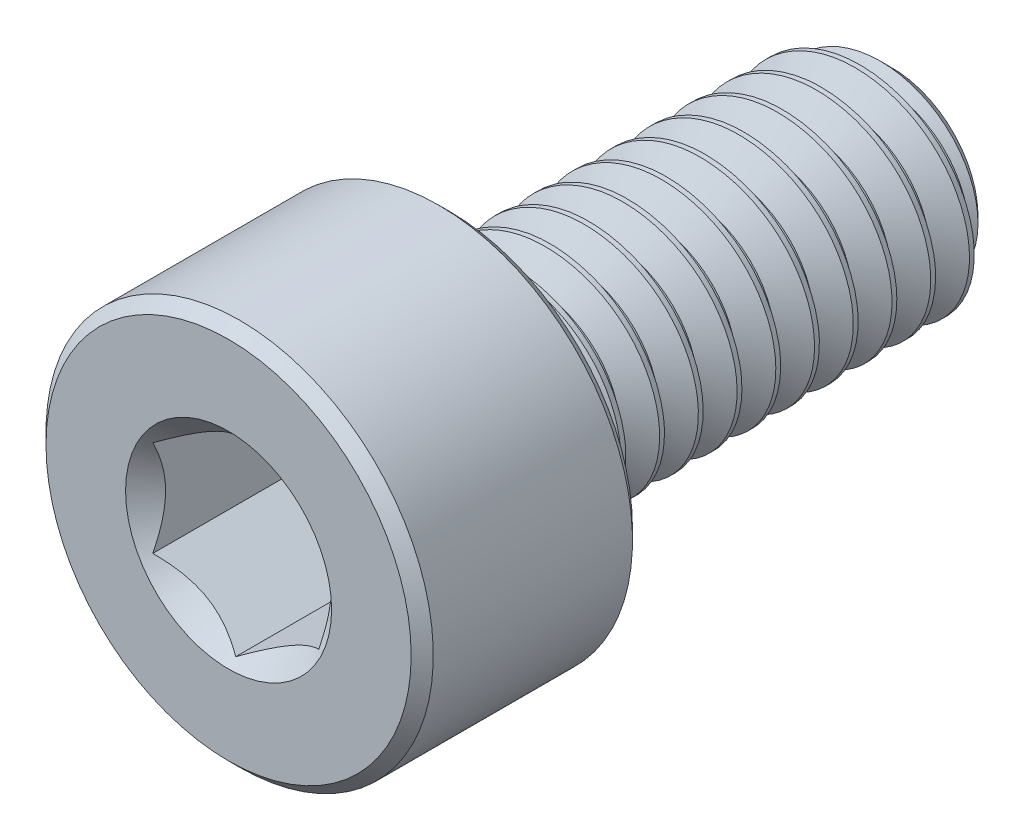
from build123d import *

# Parameters (mm, degrees)
CUT_EXTRUDE1_DEPTH     = 3
SPLIT1_SURFACE_1_BACK  = 16.556
SPLIT1_SURFACE_1_DEPTH = 33.112
SPLIT1_SURFACE_2_BACK  = 16.556
SPLIT1_SURFACE_2_DEPTH = 33.112
CUT_SWEEP1_PITCH       = 0.7


with BuildPart() as part:
    # Sketch2 → Revolve1 (revolve)
    with BuildSketch(Plane(origin=(0, 0, 0), x_dir=(0, 0, -1), z_dir=(1, 0, 0))):
        with BuildLine():
            Line((-6, 0), (-6, 3.3))
            Line((-6, 3.3), (-5.8, 3.5))
            Line((-5.8, 3.5), (-2.2, 3.5))
            Line((-2.2, 3.5), (-2, 3.3))
            Line((-2, 3.3), (-2, 2.2))
            ThreePointArc((-2, 2.2), (-1.941421356, 2.058578644), (-1.8, 2))
            Line((-1.8, 2), (5.545336663, 2))
            Line((5.545336663, 2), (6, 1.545336663))
            Line((6, 1.545336663), (6, 0))
            Line((6, 0), (-6, 0))
        make_face()
    revolve(axis=Axis((0, 0, -6), (0, 0, 1)))

    # Sketch3 → Cut-Extrude1 (cut)
    with BuildSketch(Plane.XY.offset(6)):
        Polygon((1.5, -0.866025404), (1.5, 0.866025404), (0, 1.732050808), (-1.5, 0.866025404), (-1.5, -0.866025404), (0, -1.732050808), align=None)
    extrude(amount=-CUT_EXTRUDE1_DEPTH, mode=Mode.SUBTRACT)

    # Cut-Extrude2 cone 1 section (through the dimple's axis) → Cut-Extrude2 (revolve, cut)
    with BuildSketch(Plane(origin=(0, 0, 6), x_dir=(0, -1, 0), z_dir=(1, 0, 0))):
        Polygon((0, 0), (1.861954618, 0), (0, 1.861954618), align=None)
    revolve(axis=Axis((0, 0, 6), (0, 0, -1)), mode=Mode.SUBTRACT)


with BuildPart() as body_2:
    # Split1: the piece behind the surface
    add(part.part)
    # Split1 surface: a surface, the sketch's curves swept straight by 33.112 mm
    with BuildLine(Plane(origin=(0, 0, 0), x_dir=(0, 0, -1), z_dir=(1, 0, 0)).offset(-SPLIT1_SURFACE_1_BACK), mode=Mode.PRIVATE) as split1_surface_1_path:
        Line((-1.8, -3.5), (-1.8, 3.5))
    split1_surface_1 = Shell.extrude(split1_surface_1_path.wire(), (1 * SPLIT1_SURFACE_1_DEPTH, 0 * SPLIT1_SURFACE_1_DEPTH, 0 * SPLIT1_SURFACE_1_DEPTH))
    split(bisect_by=split1_surface_1, keep=Keep.BOTTOM)

    # Cut-Sweep1: the profile of Sketch7 screwed along a right-hand helix of 12.428571 turns, 6 arcs to a turn; built about Z, then put on its axis
    cut_sweep1_z = Axis((0, 0, 0), (0, 0, 1))
    cut_sweep1_corners = [(2.037888611, 0, 0.021875), (2.037888611, 0, -0.634375), (1.545336663, 0, -0.35), (1.545336663, 0, -0.2625)]
    with BuildLine(mode=Mode.PRIVATE) as cut_sweep1_profile:
        Line(cut_sweep1_corners[0], cut_sweep1_corners[1])
        Line(cut_sweep1_corners[1], cut_sweep1_corners[2])
        Line(cut_sweep1_corners[2], cut_sweep1_corners[3])
        Line(cut_sweep1_corners[3], cut_sweep1_corners[0])
    cut_sweep1_cap = Face(cut_sweep1_profile.wire())
    cut_sweep1_turn_angles = [0, 30, 60, 90, 120, 150, 180, 210, 240, 270, 300, 330, 360]
    cut_sweep1_turn_weights = [1, 0.8660254037844387, 1, 0.8660254037844387, 1, 0.8660254037844387, 1, 0.8660254037844387, 1, 0.8660254037844387, 1, 0.8660254037844387, 1]
    cut_sweep1_turn_rails = [Edge.make_bspline([Vector(p[0], p[1], 0).rotate(cut_sweep1_z, cut_sweep1_turn_angles[k]) / cut_sweep1_turn_weights[k] + Vector(0, 0, p[2] + CUT_SWEEP1_PITCH * cut_sweep1_turn_angles[k] / 360) for k in range(13)], [0, 0, 0, 1, 1, 2, 2, 3, 3, 4, 4, 5, 5, 6, 6, 6], 2, cut_sweep1_turn_weights) for p in cut_sweep1_corners]
    cut_sweep1_turn_sides = [Face.make_surface_from_curves(cut_sweep1_turn_rails[p[0]], cut_sweep1_turn_rails[p[1]]) for p in [(0, 1), (1, 2), (2, 3), (3, 0)]]
    cut_sweep1_last_angles = [4320, 4350, 4380, 4410, 4440, 4457.142857143, 4474.285714286]
    cut_sweep1_last_weights = [1, 0.8660254037844387, 1, 0.8660254037844387, 1, 0.9555728057861561, 1]
    cut_sweep1_last_rails = [Edge.make_bspline([Vector(p[0], p[1], 0).rotate(cut_sweep1_z, cut_sweep1_last_angles[k]) / cut_sweep1_last_weights[k] + Vector(0, 0, p[2] + CUT_SWEEP1_PITCH * cut_sweep1_last_angles[k] / 360) for k in range(7)], [0, 0, 0, 1, 1, 2, 2, 3, 3, 3], 2, cut_sweep1_last_weights) for p in cut_sweep1_corners]
    cut_sweep1_last_sides = [Face.make_surface_from_curves(cut_sweep1_last_rails[p[0]], cut_sweep1_last_rails[p[1]]) for p in [(0, 1), (1, 2), (2, 3), (3, 0)]]
    cut_sweep1 = Plane(origin=(0, 0, -6), x_dir=(0, 1, 0), z_dir=(0, 0, 1)) * Solid(Shell([*[p.moved(Location((0, 0, CUT_SWEEP1_PITCH * i))) for i in range(12) for p in cut_sweep1_turn_sides], *cut_sweep1_last_sides, cut_sweep1_cap, cut_sweep1_cap.rotate(cut_sweep1_z, 4474.285714286).moved(Location((0, 0, CUT_SWEEP1_PITCH * 4474.285714286 / 360)))]))
    add(cut_sweep1, mode=Mode.SUBTRACT)


with BuildPart() as part_1:
    add(part.part)

    # Split1: split by a surface, the side it looks to stays
    # Split1 surface: a surface, the sketch's curves swept straight by 33.112 mm
    with BuildLine(Plane(origin=(0, 0, 0), x_dir=(0, 0, -1), z_dir=(1, 0, 0)).offset(-SPLIT1_SURFACE_2_BACK), mode=Mode.PRIVATE) as split1_surface_2_path:
        Line((-1.8, -3.5), (-1.8, 3.5))
    split1_surface_2 = Shell.extrude(split1_surface_2_path.wire(), (1 * SPLIT1_SURFACE_2_DEPTH, 0 * SPLIT1_SURFACE_2_DEPTH, 0 * SPLIT1_SURFACE_2_DEPTH))
    split(bisect_by=split1_surface_2, keep=Keep.TOP)

    add(body_2.part)  # Revolve2 merges body 2
    # Sketch8 → Revolve2 (revolve)
    with BuildSketch(Plane(origin=(0, 0, 0), x_dir=(0, 0, -1), z_dir=(1, 0, 0)), mode=Mode.PRIVATE) as revolve2_sk:
        Polygon((-2, 0), (-2, 2), (-1.8, 2), (-0.645299462, 0), align=None)
    revolve(revolve2_sk.sketch.rotate(Axis((0, 0, 0.645299462), (0, 0, 1)), 270), axis=Axis((0, 0, 0.645299462), (0, 0, 1)))


solid = part_1.part
